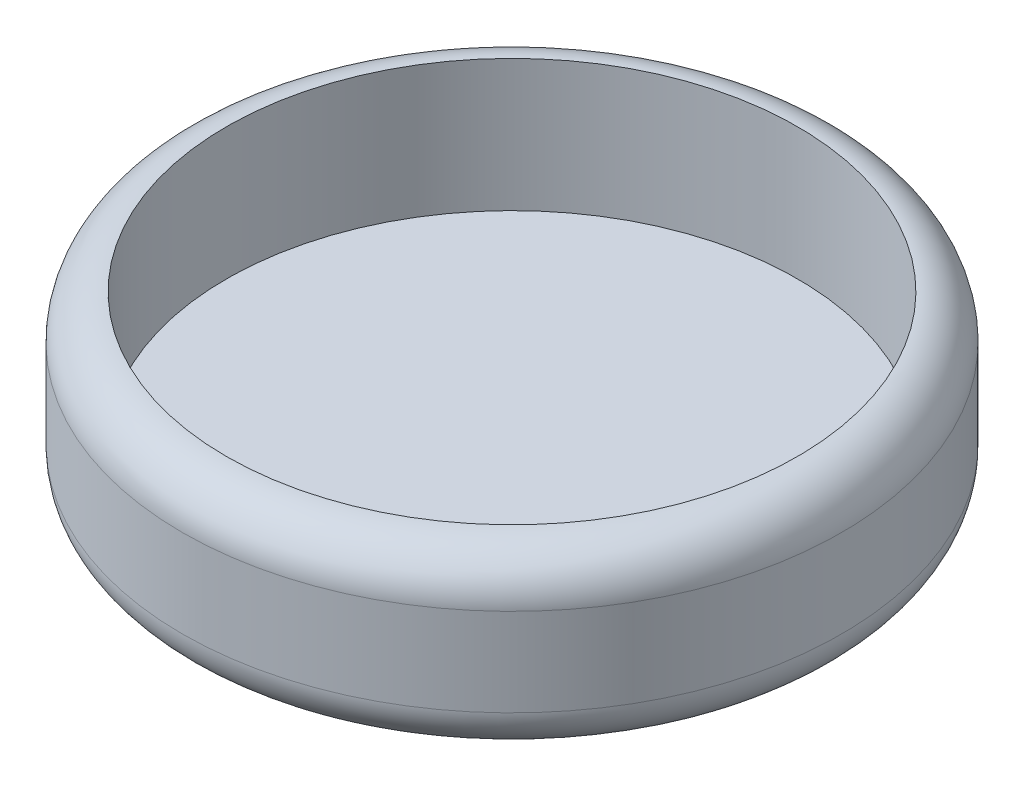
from build123d import *

# Parameters (mm, degrees)
SKETCH1_R           = 7.5
BOSS_EXTRUDE1_DEPTH = 4
SKETCH2_R           = 6.5
CUT_EXTRUDE1_DEPTH  = 3
FILLET1_R           = 1
FILLET2_R           = 1


with BuildPart() as part:
    # Sketch1 → Boss-Extrude1 (new body)
    with BuildSketch(Plane(origin=(0, 0, 0), x_dir=(1, 0, 0), z_dir=(0, 1, 0))):
        with Locations(Location((0, 0, 0), (0, 0, 270))):
            Circle(SKETCH1_R)
    extrude(amount=BOSS_EXTRUDE1_DEPTH)

    # Sketch2 → Cut-Extrude1 (cut)
    with BuildSketch(Plane(origin=(0, 4, 0), x_dir=(1, 0, 0), z_dir=(0, 1, 0))):
        with Locations(Location((0, 0, 0), (0, 0, 270))):
            Circle(SKETCH2_R)
    extrude(amount=-CUT_EXTRUDE1_DEPTH, mode=Mode.SUBTRACT)

    # Fillet1
    fillet1_edges = [part.edges().sort_by_distance(p)[0] for p in [
        (0, 4, -7.5),
    ]]
    fillet(fillet1_edges, radius=FILLET1_R - 0.0001)  # a hair under: the kernel refuses the full size

    # Fillet2
    fillet2_edges = [part.edges().sort_by_distance(p)[0] for p in [
        (0, 0, -7.5),
    ]]
    fillet(fillet2_edges, radius=FILLET2_R)


solid = part.part
